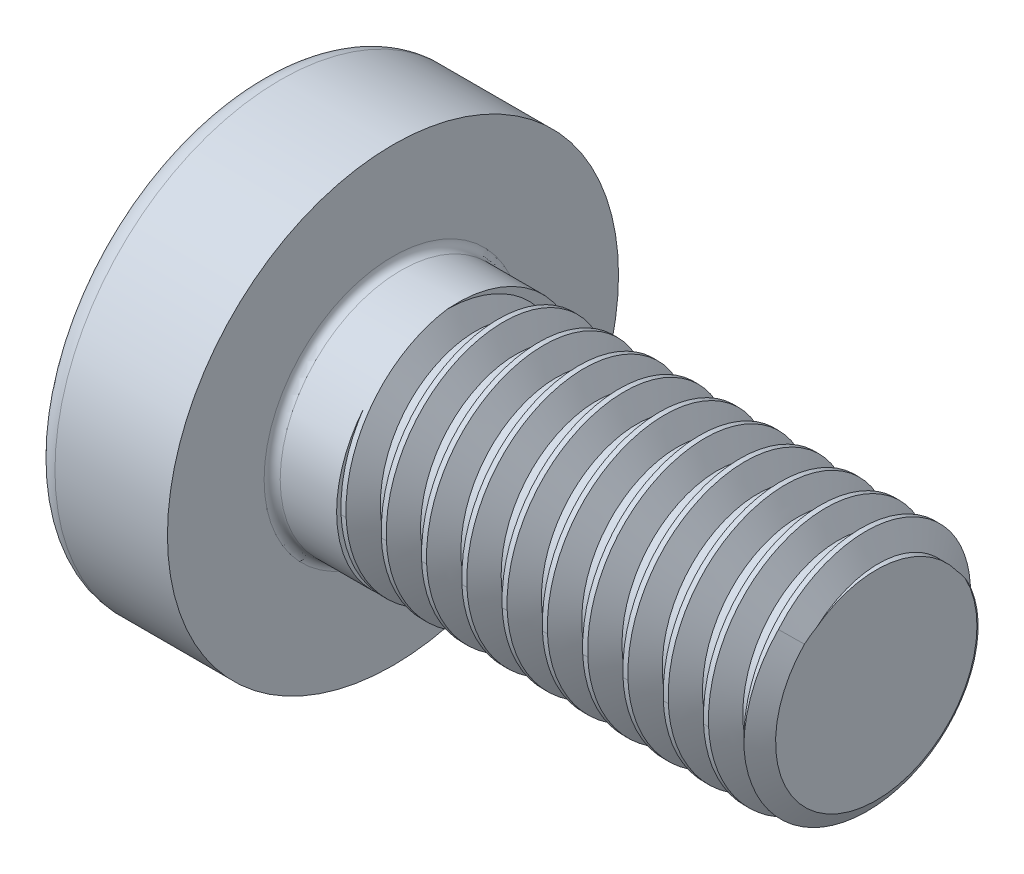
from build123d import *

# Parameters (mm, degrees)
FILLET1_R           = 0.1
CIRPATTERN1_COUNT   = 2
CIRPATTERN1_ANGLE   = 90.0000000000002
CHAMFER1_SIZE       = 0.25
CHAMFER1_SIZE2      = 0.14433756729740682
THREAD1_PITCH       = 0.5
BOSS_EXTRUDE1_START = 0.8
SKETCH8_R           = 1.5
BOSS_EXTRUDE1_DEPTH = 0.8


with BuildPart() as part:
    # Sketch2 → Revolve1 (revolve)
    with BuildSketch(Plane.XZ):
        with BuildLine():
            Line((0, 0), (-8.4, -1.08e-15))
            ThreePointArc((-8.4, -1.08e-15), (-8.20224645376158, 1.3922747564092113), (-7.624628401066268, 2.6744186046511635))
            ThreePointArc((-7.624628401066268, 2.6744186046511635), (-7.5267040293947, 2.766530149511446), (-7.396498467408688, 2.8))
            Line((-7.396498467408688, 2.8), (-6, 2.8000000000000003))
            Line((-6, 2.8000000000000003), (-6, 1.4999999999999991))
            Line((-6, 1.4999999999999991), (0, 1.5))
            Line((0, 1.5), (0, 0))
        make_face()
    revolve(axis=Axis((-2.352039512005497, 0, 0), (1, 0, 0)))

    # Fillet1
    fillet1_edges = [part.edges().sort_by_distance(p)[0] for p in [
        (-6, -1.8e-16, -1.4999999999999991),
    ]]
    fillet(fillet1_edges, radius=FILLET1_R)

    # Sketch3 → Cut-Loft1 section 0
    with BuildSketch(Plane(origin=(-8.4, 0, 0), x_dir=(0, 0, -1), z_dir=(1, 0, 0))):
        with BuildLine():
            Line((-0.3700000000000001, 1.4), (0.3699999999999999, 1.4))
            Line((0.3699999999999999, 1.4), (0.3700000000000002, -1.4))
            Line((0.3700000000000002, -1.4), (-0.3699999999999998, -1.4))
            Line((-0.3699999999999998, -1.4), (-0.3700000000000001, 1.4))
        make_face()
    # Sketch4 → Cut-Loft1 section 1
    with BuildSketch(Plane(origin=(-6.6499999999999995, 0, 0), x_dir=(0, 0, -1), z_dir=(1, 0, 0))):
        with BuildLine():
            Line((0.3699999999999999, -0.5274999999999999), (-0.3700000000000001, -0.5275))
            Line((-0.3700000000000001, -0.5275), (-0.3700000000000001, 0.5275))
            Line((-0.3700000000000001, 0.5275), (0.3699999999999999, 0.5275))
            Line((0.3699999999999999, 0.5275), (0.3699999999999999, -0.5274999999999999))
        make_face()
    cut_loft1 = loft(mode=Mode.SUBTRACT)

    # CirPattern1: Cut-Loft1 ×2 about axis
    cirpattern1_axis = Axis((0, 0, 0), (-1, 0, 0))
    for i in range(1, CIRPATTERN1_COUNT):
        add(cut_loft1.rotate(cirpattern1_axis, i * CIRPATTERN1_ANGLE / (CIRPATTERN1_COUNT - 1)), mode=Mode.SUBTRACT)

    # Sketch5 → Cut-Revolve1 (revolve, cut)
    with BuildSketch(Plane.XY, mode=Mode.PRIVATE) as cut_revolve1_sk:
        Polygon((-8.4, 0.67837192), (-8.4, 0), (-6.469344649187304, 0), (-6.650000000000001, 0.5559999990988693), align=None)
    revolve(cut_revolve1_sk.sketch.rotate(Axis((-8.4, 0, 0), (1, 0, 0)), 90), axis=Axis((-8.4, 0, 0), (1, 0, 0)), mode=Mode.SUBTRACT)

    # Chamfer1
    chamfer1_edges = [part.edges().sort_by_distance(p)[0] for p in [
        (0, -1.8e-16, -1.5),
    ]]
    chamfer1_side = [part.faces().sort_by_distance(p)[0] for p in [
        (0, 1e-16, 6.7e-16),
    ]]
    chamfer(chamfer1_edges, length=CHAMFER1_SIZE, length2=CHAMFER1_SIZE2, reference=chamfer1_side[0])

    # Thread1: arcs per turn and ends read off the stored shape
    # Thread1: the profile of Thread Profile1 profile screwed along a right-hand helix through 14.591325 turns, 6 arcs to a turn; built about Z, then put on its axis
    thread1_z = Axis((0, 0, 0), (0, 0, 1))
    thread1_corners = [(1.5003, 0, -0.000173205), (1.5003, 0, 0.437673204), (1.229367062, 0, 0.28125), (1.229367062, 0, 0.15625)]
    with BuildLine(mode=Mode.PRIVATE) as thread1_profile:
        Line(thread1_corners[0], thread1_corners[1])
        Line(thread1_corners[1], thread1_corners[2])
        Line(thread1_corners[2], thread1_corners[3])
        Line(thread1_corners[3], thread1_corners[0])
    thread1_cap = Face(thread1_profile.wire())
    thread1_turn_angles = [0, 30, 60, 90, 120, 150, 180, 210, 240, 270, 300, 330, 360]
    thread1_turn_weights = [1, 0.8660254037844387, 1, 0.8660254037844387, 1, 0.8660254037844387, 1, 0.8660254037844387, 1, 0.8660254037844387, 1, 0.8660254037844387, 1]
    thread1_turn_rails = [Edge.make_bspline([Vector(p[0], p[1], 0).rotate(thread1_z, thread1_turn_angles[k]) / thread1_turn_weights[k] + Vector(0, 0, p[2] + THREAD1_PITCH * thread1_turn_angles[k] / 360) for k in range(13)], [0, 0, 0, 1, 1, 2, 2, 3, 3, 4, 4, 5, 5, 6, 6, 6], 2, thread1_turn_weights) for p in thread1_corners]
    thread1_turn_sides = [Face.make_surface_from_curves(thread1_turn_rails[p[0]], thread1_turn_rails[p[1]]) for p in [(0, 1), (1, 2), (2, 3), (3, 0)]]
    thread1_last_angles = [5040, 5070, 5100, 5130, 5160, 5190, 5220, 5236.4385, 5252.877]
    thread1_last_weights = [1, 0.8660254037844387, 1, 0.8660254037844387, 1, 0.8660254037844387, 1, 0.9591240381406004, 1]
    thread1_last_rails = [Edge.make_bspline([Vector(p[0], p[1], 0).rotate(thread1_z, thread1_last_angles[k]) / thread1_last_weights[k] + Vector(0, 0, p[2] + THREAD1_PITCH * thread1_last_angles[k] / 360) for k in range(9)], [0, 0, 0, 1, 1, 2, 2, 3, 3, 4, 4, 4], 2, thread1_last_weights) for p in thread1_corners]
    thread1_last_sides = [Face.make_surface_from_curves(thread1_last_rails[p[0]], thread1_last_rails[p[1]]) for p in [(0, 1), (1, 2), (2, 3), (3, 0)]]
    thread1 = Plane(origin=(1.855662433, 0, 0), x_dir=(0, 0, 1), z_dir=(-1, 0, 0)) * Solid(Shell([*[p.moved(Location((0, 0, THREAD1_PITCH * i))) for i in range(14) for p in thread1_turn_sides], *thread1_last_sides, thread1_cap, thread1_cap.rotate(thread1_z, 5252.877).moved(Location((0, 0, THREAD1_PITCH * 5252.877 / 360)))]))
    add(thread1, mode=Mode.SUBTRACT)

    # Sketch8 → Boss-Extrude1 (add)
    with BuildSketch(Plane(origin=(-6, 0, 0), x_dir=(0, 0, -1), z_dir=(1, 0, 0)).offset(BOSS_EXTRUDE1_START)):
        with Locations(Location((0, 0, 0), (0, 0, 180))):
            Circle(SKETCH8_R)
    extrude(amount=-BOSS_EXTRUDE1_DEPTH)


solid = part.part
